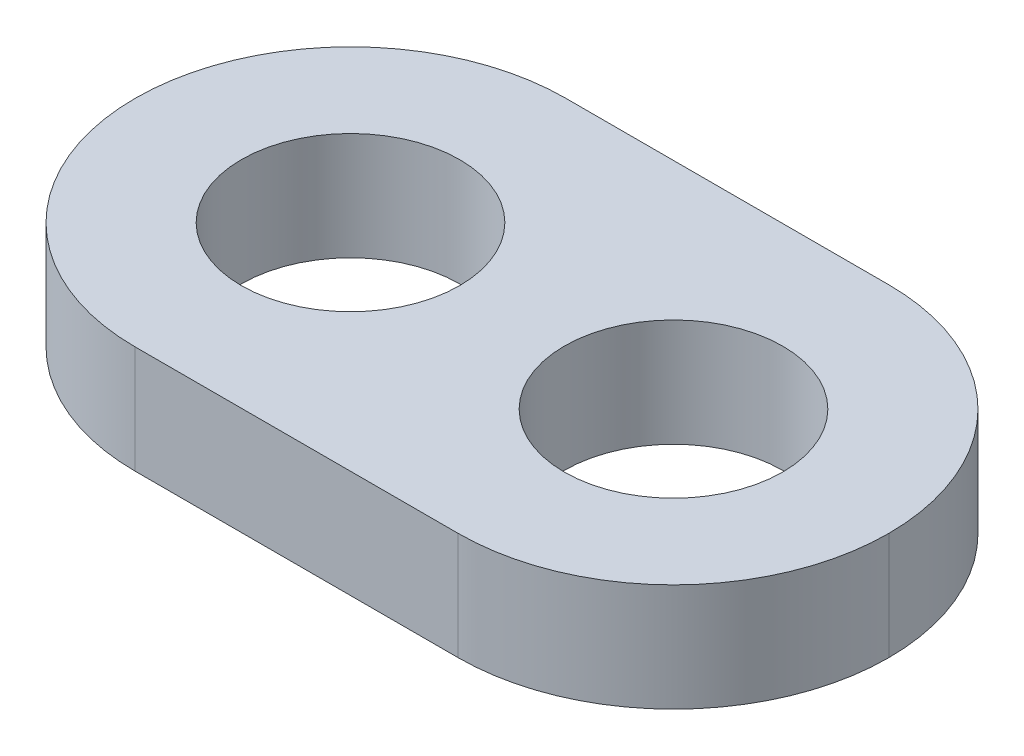
from build123d import *

# Parameters (mm, degrees)
SKETCH1_W           = 35
SKETCH1_H           = 20
SKETCH1_R           = 5.07
BOSS_EXTRUDE1_DEPTH = 5
FILLET1_R           = 10


with BuildPart() as part:
    # Sketch1 → Boss-Extrude1 (new body)
    with BuildSketch(Plane(origin=(0, 0, 0), x_dir=(1, 0, 0), z_dir=(0, 1, 0))):
        Rectangle(SKETCH1_W, SKETCH1_H)
        with Locations(Location((-7.5, 0, 0), (0, 0, 270))):
            Circle(SKETCH1_R, mode=Mode.SUBTRACT)
        with Locations(Location((7.5, 0, 0), (0, 0, 90))):
            Circle(SKETCH1_R, mode=Mode.SUBTRACT)
    extrude(amount=BOSS_EXTRUDE1_DEPTH)

    # Fillet1
    fillet1_edges = [part.edges().sort_by_distance(p)[0] for p in [
        (-17.5, 2.5, -10),
        (17.5, 2.5, -10),
        (17.5, 2.5, 10),
        (-17.5, 2.5, 10),
    ]]
    fillet(fillet1_edges, radius=FILLET1_R - 0.0001)  # a hair under: the kernel refuses the full size


solid = part.part
